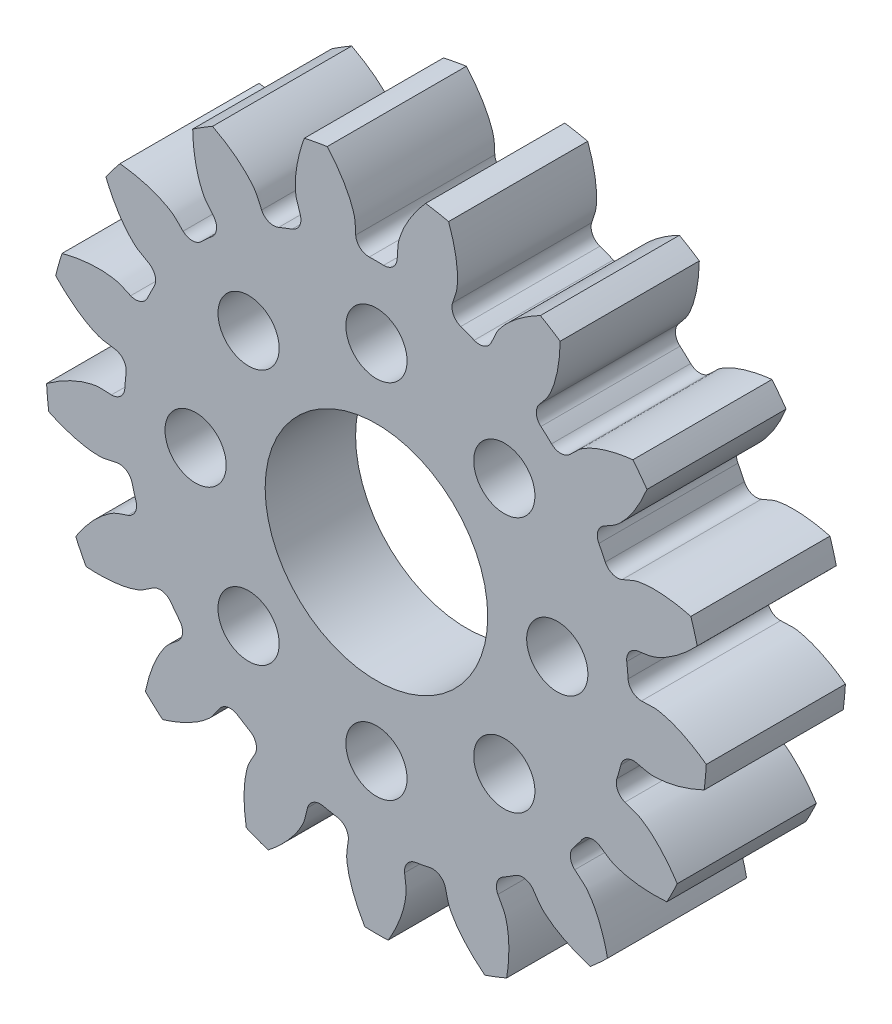
from build123d import *
from OCP.BRepAlgoAPI import BRepAlgoAPI_Cut
from OCP.TopTools import TopTools_ListOfShape

# Parameters (mm, degrees)
SKETCH_1_R          = 9.5
LASHENA_DEPTH       = 4
CUT_EXTRUDEA_DEPTH  = 30
WWW_KYTOOL_CN_COUNT = 17
SCALE_1_SCALE       = 1.25
SKETCH_3_R          = 9
CUT_EXTRUDE_2_DEPTH = 1.75
SKETCH_4_R          = 2.5
CUT_EXTRUDE_3_DEPTH = 18.091963807
SKETCH_5_R          = 4
CUT_EXTRUDE_4_DEPTH = 18.509218246
SKETCH_7_R          = 1.1
CUT_EXTRUDE_5_DEPTH = 18.509220538


with BuildPart() as part:
    # 草图1 → LaShenA (new body)
    with BuildSketch(Plane.XY):
        Circle(SKETCH_1_R)
    extrude(amount=LASHENA_DEPTH)

    # SketchA → Cut-ExtrudeA (cut)
    with BuildSketch(Plane.XY.offset(4)):
        with BuildLine():
            ThreePointArc((0.207024597, 7.247043591), (0, 7.25), (-0.207024597, 7.247043591))
            ThreePointArc((-0.207024597, 7.247043591), (-0.472242082, 7.34458089), (-0.596793745, 7.59823562))
            add(Edge.make_bspline(
                [(-0.596793745, 7.59823562), (-0.606044253, 7.720567809), (-0.602564219, 7.869795024), (-0.629607947, 8.02899806), (-0.642220103, 8.080828168), (-0.653298413, 8.121829162), (-0.66746571, 8.16874208), (-0.685015757, 8.221435372), (-0.706306024, 8.279743397), (-0.731664706, 8.343492078), (-0.761420108, 8.412490908), (-0.795890592, 8.486535833), (-0.835386998, 8.565408724), (-0.880211198, 8.648877936), (-0.930655859, 8.736698559), (-0.987003843, 8.828612781), (-1.049527739, 8.924350251), (-1.118489374, 9.023628457), (-1.194139339, 9.126153124), (-1.276716542, 9.23161863), (-1.36644775, 9.339708439), (-1.463547201, 9.450095543), (-1.568216064, 9.562442937), (-1.721177274, 9.717492078), (-1.84330532, 9.830913041), (-1.928368213, 9.905667778)],
                knots=[0.121183801, 0.121183801, 0.121183801, 0.121183801, 0.238205786, 0.264316947, 0.275811996, 0.289397053, 0.305072119, 0.322837193, 0.342692276, 0.364637367, 0.388672467, 0.414797575, 0.443012693, 0.473317818, 0.505712953, 0.540198096, 0.576773247, 0.615438407, 0.656193576, 0.699038754, 0.74397394, 0.790999135, 0.840114338, 0.89131955, 1, 1, 1, 1], degree=3))
            ThreePointArc((-1.928368213, 9.905667778), (0, 10.091623165), (1.928368213, 9.905667778))
            add(Edge.make_bspline(
                [(0.596793745, 7.59823562), (0.606044253, 7.720567809), (0.602564219, 7.869795024), (0.629607947, 8.02899806), (0.642220103, 8.080828168), (0.653298413, 8.121829162), (0.66746571, 8.16874208), (0.685015757, 8.221435372), (0.706306024, 8.279743397), (0.731664706, 8.343492078), (0.761420108, 8.412490908), (0.795890592, 8.486535833), (0.835386998, 8.565408724), (0.880211198, 8.648877936), (0.930655859, 8.736698559), (0.987003843, 8.828612781), (1.049527739, 8.924350251), (1.118489374, 9.023628457), (1.194139339, 9.126153124), (1.276716542, 9.23161863), (1.36644775, 9.339708439), (1.463547201, 9.450095543), (1.568216064, 9.562442937), (1.721177274, 9.717492078), (1.84330532, 9.830913041), (1.928368213, 9.905667778)],
                knots=[0.121183801, 0.121183801, 0.121183801, 0.121183801, 0.238205786, 0.264316947, 0.275811996, 0.289397053, 0.305072119, 0.322837193, 0.342692276, 0.364637367, 0.388672467, 0.414797575, 0.443012693, 0.473317818, 0.505712953, 0.540198096, 0.576773247, 0.615438407, 0.656193576, 0.699038754, 0.74397394, 0.790999135, 0.840114338, 0.89131955, 1, 1, 1, 1], degree=3))
            ThreePointArc((0.596793745, 7.59823562), (0.472242082, 7.34458089), (0.207024597, 7.247043591))
        make_face()
    cut_extrudea = extrude(amount=-CUT_EXTRUDEA_DEPTH, mode=Mode.SUBTRACT)

    # www.KYTool.cn: Cut-ExtrudeA ×17 about axis
    www_kytool_cn_axis = Axis((0, 0, -88.99), (0, 0, 1))
    for i in range(1, WWW_KYTOOL_CN_COUNT):
        add(cut_extrudea.rotate(www_kytool_cn_axis, i * 360 / WWW_KYTOOL_CN_COUNT), mode=Mode.SUBTRACT)


with BuildPart() as part_1:
    # 缩放比例1: scaled about (-6e-08, -3.34e-07, 1.999999564)
    add(part.part.scale(SCALE_1_SCALE).moved(Location((1.5e-08, 8.3e-08, -0.499999891))))


with BuildPart() as cut_extrude_2_tool:
    # 草图3 → 切除-拉伸2 (new body)
    with BuildSketch(Plane(origin=(0, 0, -0.499998878), x_dir=(-1, 0, 0), z_dir=(0, 0, -1))):
        Circle(SKETCH_3_R)
    extrude(amount=-CUT_EXTRUDE_2_DEPTH)


with BuildPart() as part_2:
    add(part_1.part)

    # 切除-拉伸2: cut by cut_extrude_2_tool, with a tolerance
    cut_extrude_2_stock = TopTools_ListOfShape()
    cut_extrude_2_stock.Append(part_2.part.wrapped)
    cut_extrude_2_tools = TopTools_ListOfShape()
    cut_extrude_2_tools.Append(cut_extrude_2_tool.part.wrapped)
    cut_extrude_2_cut = BRepAlgoAPI_Cut()
    cut_extrude_2_cut.SetArguments(cut_extrude_2_stock)
    cut_extrude_2_cut.SetTools(cut_extrude_2_tools)
    cut_extrude_2_cut.SetFuzzyValue(0.00001)
    cut_extrude_2_cut.Build()
    add(Compound.cast(cut_extrude_2_cut.Shape()).solids(), mode=Mode.REPLACE)

    # 草图4 → 切除-拉伸3 (cut, through all)
    with BuildSketch(Plane(origin=(0, 0, 1.250001122), x_dir=(-1, 0, 0), z_dir=(0, 0, -1))):
        Circle(SKETCH_4_R)
    extrude(amount=-CUT_EXTRUDE_3_DEPTH, mode=Mode.SUBTRACT)

    # 草图5 → 切除-拉伸4 (cut, through all)
    with BuildSketch(Plane(origin=(0, 0, -0.499998878), x_dir=(-1, 0, 0), z_dir=(0, 0, -1))):
        Circle(SKETCH_5_R)
    extrude(amount=-CUT_EXTRUDE_4_DEPTH, mode=Mode.SUBTRACT)

    # 草图7 → 切除-拉伸5 (cut, through all)
    with BuildSketch(Plane.XY.offset(4.500001122)):
        with Locations((0, 6.5)):
            Circle(SKETCH_7_R)
        with Locations((4.596194078, 4.596194078)):
            Circle(SKETCH_7_R)
        with Locations((6.5, 0)):
            Circle(SKETCH_7_R)
        with Locations((4.596194078, -4.596194078)):
            Circle(SKETCH_7_R)
        with Locations((0, -6.5)):
            Circle(SKETCH_7_R)
        with Locations((-4.596194078, -4.596194078)):
            Circle(SKETCH_7_R)
        with Locations((-6.5, 0)):
            Circle(SKETCH_7_R)
        with Locations((-4.596194078, 4.596194078)):
            Circle(SKETCH_7_R)
    extrude(amount=-CUT_EXTRUDE_5_DEPTH, mode=Mode.SUBTRACT)


solid = part_2.part
